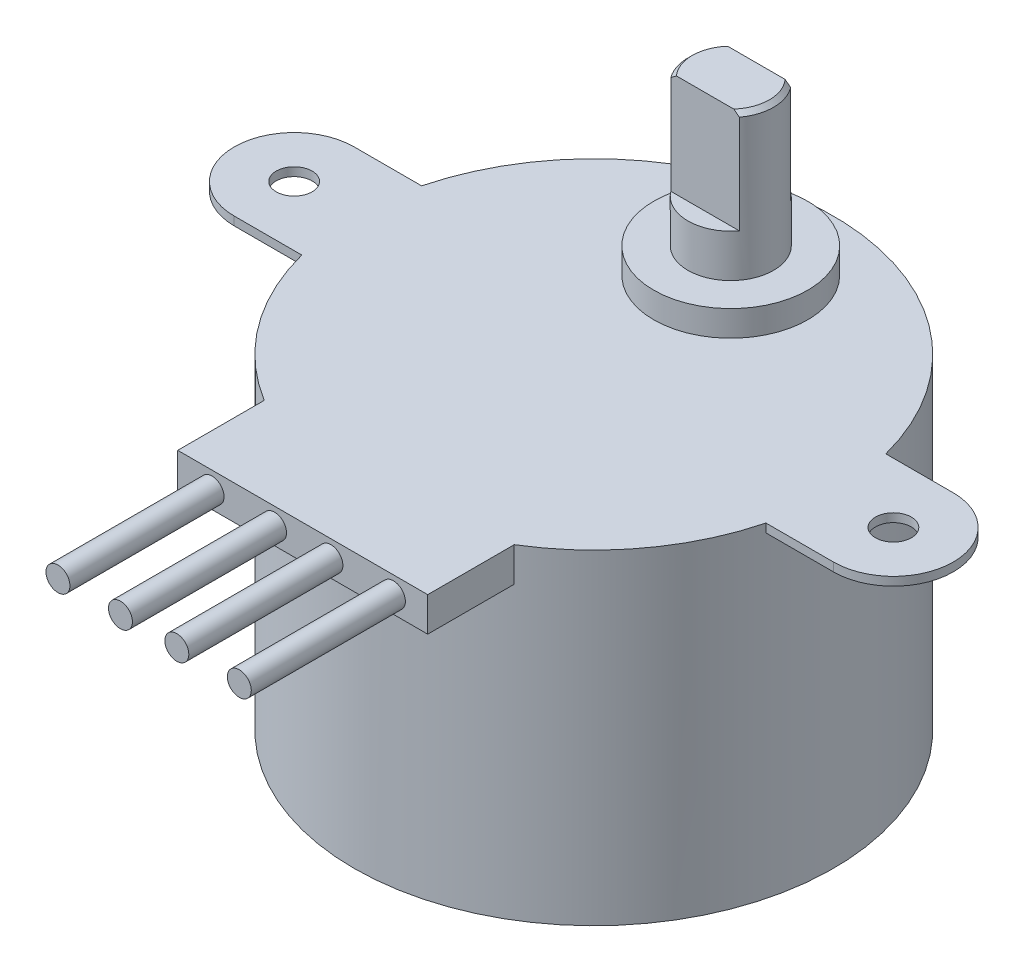
from build123d import *

# Parameters (mm, degrees)
SKETCH1_R           = 14
BOSS_EXTRUDE1_DEPTH = 19
SKETCH2_R           = 4.5
BOSS_EXTRUDE2_DEPTH = 1.5
SKETCH3_R           = 2.5
BOSS_EXTRUDE3_DEPTH = 2.5
SKETCH4_R           = 2.5
BOSS_EXTRUDE4_DEPTH = 6
CHAMFER1_SIZE       = 0.25
BOSS_EXTRUDE5_START = -0.5
SKETCH6_R           = 1.05
BOSS_EXTRUDE5_DEPTH = 0.5
CUT_EXTRUDE1_DEPTH  = 6
SKETCH8_W           = 14.6
SKETCH8_H           = 17
BOSS_EXTRUDE6_DEPTH = 2
SKETCH9_R           = 0.7
BOSS_EXTRUDE7_DEPTH = 9


with BuildPart() as part:
    # Sketch1 → Boss-Extrude1 (new body)
    with BuildSketch(Plane(origin=(0, 0, 0), x_dir=(1, 0, 0), z_dir=(0, 1, 0))):
        Circle(SKETCH1_R)
    extrude(amount=BOSS_EXTRUDE1_DEPTH)

    # Sketch2 → Boss-Extrude2 (add)
    with BuildSketch(Plane(origin=(0, 19, 0), x_dir=(1, 0, 0), z_dir=(0, 1, 0))):
        with Locations((0, 8)):
            Circle(SKETCH2_R)
    extrude(amount=BOSS_EXTRUDE2_DEPTH)

    # Sketch3 → Boss-Extrude3 (add)
    with BuildSketch(Plane(origin=(0, 20.5, 0), x_dir=(1, 0, 0), z_dir=(0, 1, 0))):
        with Locations((0, 8)):
            Circle(SKETCH3_R)
    extrude(amount=BOSS_EXTRUDE3_DEPTH)

    # Sketch4 → Boss-Extrude4 (add)
    with BuildSketch(Plane(origin=(0, 23, 0), x_dir=(1, 0, 0), z_dir=(0, 1, 0))):
        with Locations((0, 8)):
            Circle(SKETCH4_R)
    extrude(amount=BOSS_EXTRUDE4_DEPTH)

    # Chamfer1
    chamfer1_edges = [part.edges().sort_by_distance(p)[0] for p in [
        (-2.5, 29, -8),
    ]]
    chamfer(chamfer1_edges, length=CHAMFER1_SIZE)

    # Sketch6 → Boss-Extrude5 (add)
    # profile 1 of 2: a face of its own
    with BuildSketch(Plane(origin=(0, 19, 0), x_dir=(1, 0, 0), z_dir=(0, 1, 0)).offset(BOSS_EXTRUDE5_START)):
        with BuildLine():
            Line((-13.555441712, 3.5), (-17.5, 3.5))
            ThreePointArc((-17.5, 3.5), (-21, 0), (-17.5, -3.5))
            Line((-17.5, -3.5), (-13.555441712, -3.5))
            ThreePointArc((-13.555441712, -3.5), (-14, 0), (-13.555441712, 3.5))
        make_face()
        with Locations((-17.5, 0)):
            Circle(SKETCH6_R, mode=Mode.SUBTRACT)
    # profile 2 of 2: a face of its own
    with BuildSketch(Plane(origin=(0, 19, 0), x_dir=(1, 0, 0), z_dir=(0, 1, 0)).offset(BOSS_EXTRUDE5_START)):
        with BuildLine():
            Line((17.5, 3.5), (13.555441712, 3.5))
            ThreePointArc((13.555441712, 3.5), (14, 0), (13.555441712, -3.5))
            Line((13.555441712, -3.5), (17.5, -3.5))
            ThreePointArc((17.5, -3.5), (21, 0), (17.5, 3.5))
        make_face()
        with Locations((17.5, 0)):
            Circle(SKETCH6_R, mode=Mode.SUBTRACT)
    extrude(amount=BOSS_EXTRUDE5_DEPTH)

    # Sketch7 → Cut-Extrude1 (cut)
    with BuildSketch(Plane(origin=(0, 29, 0), x_dir=(1, 0, 0), z_dir=(0, 1, 0))):
        Polygon((0, 9.5), (-3.852733209, 9.5), (-3.852733209, 12.808282557), (3.692444336, 12.808282557), (3.692444336, 9.5), align=None)
        Polygon((3.692444336, 6.5), (0, 6.5), (-3.852733209, 6.5), (-3.852733209, 3.191717443), (3.692444336, 3.191717443), align=None)
    extrude(amount=-CUT_EXTRUDE1_DEPTH, mode=Mode.SUBTRACT)

    # Sketch8 → Boss-Extrude6 (add)
    with BuildSketch(Plane(origin=(0, 19, 0), x_dir=(1, 0, 0), z_dir=(0, 1, 0))):
        with Locations((0, -8.5)):
            Rectangle(SKETCH8_W, SKETCH8_H)
    extrude(amount=-BOSS_EXTRUDE6_DEPTH)

    # Sketch9 → Boss-Extrude7 (add)
    with BuildSketch(Plane.XY.offset(17)):
        with Locations((-5.295828478, 18)):
            Circle(SKETCH9_R)
        with Locations((-1.645828478, 18)):
            Circle(SKETCH9_R)
        with Locations((1.645828478, 18)):
            Circle(SKETCH9_R)
        with Locations((5.295828478, 18)):
            Circle(SKETCH9_R)
    extrude(amount=BOSS_EXTRUDE7_DEPTH)


solid = part.part
